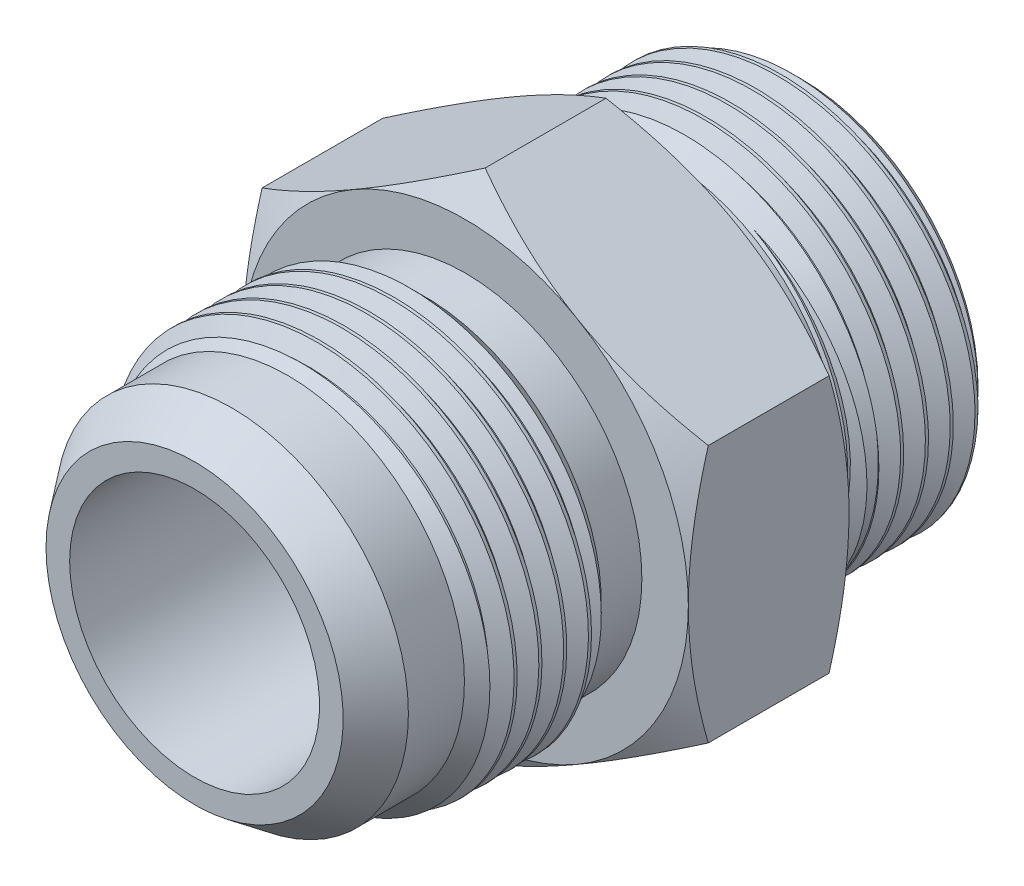
from build123d import *

# Parameters (mm, degrees)
BOSS_EXTRUDE1_DEPTH = 13.716
SKETCH6_OUTSIDE_W   = 200.736
SKETCH6_OUTSIDE_H   = 206.63
SKETCH6_OUTSIDE_R   = 19.05
CUT_EXTRUDE1_DEPTH  = 41.872696314
CUT_EXTRUDE1_DRAFT  = -60
SKETCH7_OUTSIDE_W   = 221.748
SKETCH7_OUTSIDE_H   = 227.642
SKETCH7_OUTSIDE_R   = 19.05
CUT_EXTRUDE2_DEPTH  = 47.938485276
CUT_EXTRUDE2_DRAFT  = -60
SKETCH8_R           = 0.79375
CUT_SWEEP1_PITCH    = 2.116666667
CUT_SWEEP2_PITCH    = 2.116666667
BOSS_EXTRUDE2_START = -13.716
SKETCH13_R          = 19.05
SKETCH13_R_2        = 10.668
BOSS_EXTRUDE2_DEPTH = 13.716


with BuildPart() as part:
    # Sketch3 → Revolve1 (revolve)
    with BuildSketch(Plane(origin=(0, 0, 0), x_dir=(0, 0, -1), z_dir=(1, 0, 0)), mode=Mode.PRIVATE) as revolve1_sk:
        Polygon((-6.2611, 15.08125), (-2.794, 15.08125), (10.922, 15.08125), (14.224, 15.08125), (15.8115, 16.66875), (24.3205, 16.66875), (25.908, 15.08125), (25.908, 10.668), (10.922, 10.668), (-2.794, 10.668), (-25.908, 10.668), (-25.908, 12.6873), (-22.731121049, 15.08125), (-17.9451, 15.08125), (-16.3576, 16.66875), (-7.8486, 16.66875), align=None)
    revolve(revolve1_sk.sketch.rotate(Axis((0, 0, -25.908), (0, 0, 1)), 90), axis=Axis((0, 0, -25.908), (0, 0, 1)))

    # Sketch4 → Boss-Extrude1 (add)
    with BuildSketch(Plane.XY.offset(2.794)):
        Polygon((-19.05, 10.998522628), (-19.05, -10.998522628), (0, -21.997045256), (19.05, -10.998522628), (19.05, 10.998522628), (0, 21.997045256), align=None)
    extrude(amount=-BOSS_EXTRUDE1_DEPTH)

    # Sketch5 → Cut-Revolve1 (revolve, cut)
    with BuildSketch(Plane(origin=(0, 0, 0), x_dir=(0, 0, -1), z_dir=(1, 0, 0)), mode=Mode.PRIVATE) as cut_revolve1_sk:
        Polygon((25.908, 0), (-25.908, 0), (-25.908, 10.668), (-2.794, 10.668), (10.922, 10.668), (25.908, 10.668), align=None)
    revolve(cut_revolve1_sk.sketch.rotate(Axis((0, 0, -25.908), (0, 0, 1)), 90), axis=Axis((0, 0, -25.908), (0, 0, 1)), mode=Mode.SUBTRACT)


with BuildPart() as cut_extrude1_tool:
    # Sketch6 outside → Cut-Extrude1 (with draft: the straight prism first)
    with BuildSketch(Plane.XY.offset(2.794)):
        Rectangle(SKETCH6_OUTSIDE_W, SKETCH6_OUTSIDE_H)
        Circle(SKETCH6_OUTSIDE_R, mode=Mode.SUBTRACT)
    extrude(amount=-CUT_EXTRUDE1_DEPTH)
    # Cut-Extrude1: the draft: its side faces are tilted about the plane it starts from
    cut_extrude1_sides = [cut_extrude1_tool.faces().sort_by_distance(p)[0] for p in [
        (0, -103.315, -18.142348157),
        (100.368, 0, -18.142348157),
        (0, 103.315, -18.142348157),
        (-100.368, 0, -18.142348157),
        (-19.05, 0, -18.142348157),
    ]]
    draft(cut_extrude1_sides, Plane.XY.offset(2.794), CUT_EXTRUDE1_DRAFT)


with BuildPart() as part_1:
    add(part.part)

    # Cut-Extrude1: cut by cut_extrude1_tool
    add(cut_extrude1_tool.part, mode=Mode.SUBTRACT)


with BuildPart() as cut_extrude2_tool:
    # Sketch7 outside → Cut-Extrude2 (with draft: the straight prism first)
    with BuildSketch(Plane(origin=(0, 0, -10.922), x_dir=(-1, 0, 0), z_dir=(0, 0, -1))):
        Rectangle(SKETCH7_OUTSIDE_W, SKETCH7_OUTSIDE_H)
        Circle(SKETCH7_OUTSIDE_R, mode=Mode.SUBTRACT)
    extrude(amount=-CUT_EXTRUDE2_DEPTH)
    # Cut-Extrude2: the draft: its side faces are tilted about the plane it starts from
    cut_extrude2_sides = [cut_extrude2_tool.faces().sort_by_distance(p)[0] for p in [
        (0, -113.821, 13.047242638),
        (-110.874, 0, 13.047242638),
        (0, 113.821, 13.047242638),
        (110.874, 0, 13.047242638),
        (19.05, 0, 13.047242638),
    ]]
    draft(cut_extrude2_sides, Plane(origin=(0, 0, -10.922), x_dir=(-1, 0, 0), z_dir=(0, 0, -1)), CUT_EXTRUDE2_DRAFT)


with BuildPart() as part_2:
    add(part_1.part)

    # Cut-Extrude2: cut by cut_extrude2_tool
    add(cut_extrude2_tool.part, mode=Mode.SUBTRACT)

    # Cut-Sweep1: the profile of Sketch10 screwed along a right-hand helix of 6.52 turns, 10 arcs to a turn; built about Z, then put on its axis
    cut_sweep1_z = Axis((0, 0, 0), (0, 0, 1))
    cut_sweep1_corners = [(15.293934671, 0, -1.058333333), (15.293934671, 0, -0.79375), (16.783317944, 0, 0.066145833), (16.783317944, 0, -1.918229167)]
    with BuildLine(mode=Mode.PRIVATE) as cut_sweep1_profile:
        Line(cut_sweep1_corners[0], cut_sweep1_corners[1])
        Line(cut_sweep1_corners[1], cut_sweep1_corners[2])
        Line(cut_sweep1_corners[2], cut_sweep1_corners[3])
        Line(cut_sweep1_corners[3], cut_sweep1_corners[0])
    cut_sweep1_cap = Face(cut_sweep1_profile.wire())
    cut_sweep1_turn_angles = [0, 18, 36, 54, 72, 90, 108, 126, 144, 162, 180, 198, 216, 234, 252, 270, 288, 306, 324, 342, 360]
    cut_sweep1_turn_weights = [1, 0.9510565162951535, 1, 0.9510565162951535, 1, 0.9510565162951535, 1, 0.9510565162951535, 1, 0.9510565162951535, 1, 0.9510565162951535, 1, 0.9510565162951535, 1, 0.9510565162951535, 1, 0.9510565162951535, 1, 0.9510565162951535, 1]
    cut_sweep1_turn_rails = [Edge.make_bspline([Vector(p[0], p[1], 0).rotate(cut_sweep1_z, cut_sweep1_turn_angles[k]) / cut_sweep1_turn_weights[k] + Vector(0, 0, p[2] + CUT_SWEEP1_PITCH * cut_sweep1_turn_angles[k] / 360) for k in range(21)], [0, 0, 0, 1, 1, 2, 2, 3, 3, 4, 4, 5, 5, 6, 6, 7, 7, 8, 8, 9, 9, 10, 10, 10], 2, cut_sweep1_turn_weights) for p in cut_sweep1_corners]
    cut_sweep1_turn_sides = [Face.make_surface_from_curves(cut_sweep1_turn_rails[p[0]], cut_sweep1_turn_rails[p[1]]) for p in [(0, 1), (1, 2), (2, 3), (3, 0)]]
    cut_sweep1_last_angles = [2160, 2178, 2196, 2214, 2232, 2250, 2268, 2286, 2304, 2322, 2340, 2343.6, 2347.2]
    cut_sweep1_last_weights = [1, 0.9510565162951535, 1, 0.9510565162951535, 1, 0.9510565162951535, 1, 0.9510565162951535, 1, 0.9510565162951535, 1, 0.9980267284282605, 1]
    cut_sweep1_last_rails = [Edge.make_bspline([Vector(p[0], p[1], 0).rotate(cut_sweep1_z, cut_sweep1_last_angles[k]) / cut_sweep1_last_weights[k] + Vector(0, 0, p[2] + CUT_SWEEP1_PITCH * cut_sweep1_last_angles[k] / 360) for k in range(13)], [0, 0, 0, 1, 1, 2, 2, 3, 3, 4, 4, 5, 5, 6, 6, 6], 2, cut_sweep1_last_weights) for p in cut_sweep1_corners]
    cut_sweep1_last_sides = [Face.make_surface_from_curves(cut_sweep1_last_rails[p[0]], cut_sweep1_last_rails[p[1]]) for p in [(0, 1), (1, 2), (2, 3), (3, 0)]]
    cut_sweep1 = Plane(origin=(0, 0, 17.9451), x_dir=(0, 1, 0), z_dir=(0, 0, -1)) * Solid(Shell([*[p.moved(Location((0, 0, CUT_SWEEP1_PITCH * i))) for i in range(6) for p in cut_sweep1_turn_sides], *cut_sweep1_last_sides, cut_sweep1_cap, cut_sweep1_cap.rotate(cut_sweep1_z, 2347.2).moved(Location((0, 0, CUT_SWEEP1_PITCH * 2347.2 / 360)))]))
    add(cut_sweep1, mode=Mode.SUBTRACT)

    # Cut-Sweep2: the profile of Sketch12 screwed along a right-hand helix of 6.52 turns, 10 arcs to a turn; built about Z, then put on its axis
    cut_sweep2_z = Axis((0, 0, 0), (0, 0, 1))
    cut_sweep2_corners = [(15.293934671, 0, -0.79375), (16.783317944, 0, 0.066145833), (16.783317944, 0, -1.918229167), (15.293934671, 0, -1.058333333)]
    with BuildLine(mode=Mode.PRIVATE) as cut_sweep2_profile:
        Line(cut_sweep2_corners[0], cut_sweep2_corners[1])
        Line(cut_sweep2_corners[1], cut_sweep2_corners[2])
        Line(cut_sweep2_corners[2], cut_sweep2_corners[3])
        Line(cut_sweep2_corners[3], cut_sweep2_corners[0])
    cut_sweep2_cap = Face(cut_sweep2_profile.wire())
    cut_sweep2_turn_angles = [0, 18, 36, 54, 72, 90, 108, 126, 144, 162, 180, 198, 216, 234, 252, 270, 288, 306, 324, 342, 360]
    cut_sweep2_turn_weights = [1, 0.9510565162951535, 1, 0.9510565162951535, 1, 0.9510565162951535, 1, 0.9510565162951535, 1, 0.9510565162951535, 1, 0.9510565162951535, 1, 0.9510565162951535, 1, 0.9510565162951535, 1, 0.9510565162951535, 1, 0.9510565162951535, 1]
    cut_sweep2_turn_rails = [Edge.make_bspline([Vector(p[0], p[1], 0).rotate(cut_sweep2_z, cut_sweep2_turn_angles[k]) / cut_sweep2_turn_weights[k] + Vector(0, 0, p[2] + CUT_SWEEP2_PITCH * cut_sweep2_turn_angles[k] / 360) for k in range(21)], [0, 0, 0, 1, 1, 2, 2, 3, 3, 4, 4, 5, 5, 6, 6, 7, 7, 8, 8, 9, 9, 10, 10, 10], 2, cut_sweep2_turn_weights) for p in cut_sweep2_corners]
    cut_sweep2_turn_sides = [Face.make_surface_from_curves(cut_sweep2_turn_rails[p[0]], cut_sweep2_turn_rails[p[1]]) for p in [(0, 1), (1, 2), (2, 3), (3, 0)]]
    cut_sweep2_last_angles = [2160, 2178, 2196, 2214, 2232, 2250, 2268, 2286, 2304, 2322, 2340, 2343.6, 2347.2]
    cut_sweep2_last_weights = [1, 0.9510565162951535, 1, 0.9510565162951535, 1, 0.9510565162951535, 1, 0.9510565162951535, 1, 0.9510565162951535, 1, 0.9980267284282599, 1]
    cut_sweep2_last_rails = [Edge.make_bspline([Vector(p[0], p[1], 0).rotate(cut_sweep2_z, cut_sweep2_last_angles[k]) / cut_sweep2_last_weights[k] + Vector(0, 0, p[2] + CUT_SWEEP2_PITCH * cut_sweep2_last_angles[k] / 360) for k in range(13)], [0, 0, 0, 1, 1, 2, 2, 3, 3, 4, 4, 5, 5, 6, 6, 6], 2, cut_sweep2_last_weights) for p in cut_sweep2_corners]
    cut_sweep2_last_sides = [Face.make_surface_from_curves(cut_sweep2_last_rails[p[0]], cut_sweep2_last_rails[p[1]]) for p in [(0, 1), (1, 2), (2, 3), (3, 0)]]
    cut_sweep2 = Plane(origin=(0, 0, -25.908), x_dir=(0, 1, 0), z_dir=(0, 0, 1)) * Solid(Shell([*[p.moved(Location((0, 0, CUT_SWEEP2_PITCH * i))) for i in range(6) for p in cut_sweep2_turn_sides], *cut_sweep2_last_sides, cut_sweep2_cap, cut_sweep2_cap.rotate(cut_sweep2_z, 2347.2).moved(Location((0, 0, CUT_SWEEP2_PITCH * 2347.2 / 360)))]))
    add(cut_sweep2, mode=Mode.SUBTRACT)

    # Sketch13 → Boss-Extrude2 (add)
    with BuildSketch(Plane(origin=(0, 0, -10.922), x_dir=(-1, 0, 0), z_dir=(0, 0, -1)).offset(BOSS_EXTRUDE2_START)):
        Circle(SKETCH13_R)
        Circle(SKETCH13_R_2, mode=Mode.SUBTRACT)
    extrude(amount=BOSS_EXTRUDE2_DEPTH)


with BuildPart() as body_2:
    # Sketch8 → Revolve2 (revolve)
    with BuildSketch(Plane(origin=(0, 0, 0), x_dir=(0, 0, -1), z_dir=(1, 0, 0)), mode=Mode.PRIVATE) as revolve2_sk:
        with Locations((11.71575, 15.875)):
            Circle(SKETCH8_R)
    revolve(revolve2_sk.sketch.rotate(Axis((0, 0, -25.908), (0, 0, 1)), 90), axis=Axis((0, 0, -25.908), (0, 0, 1)))


solid = Compound([part_2.part, body_2.part])
